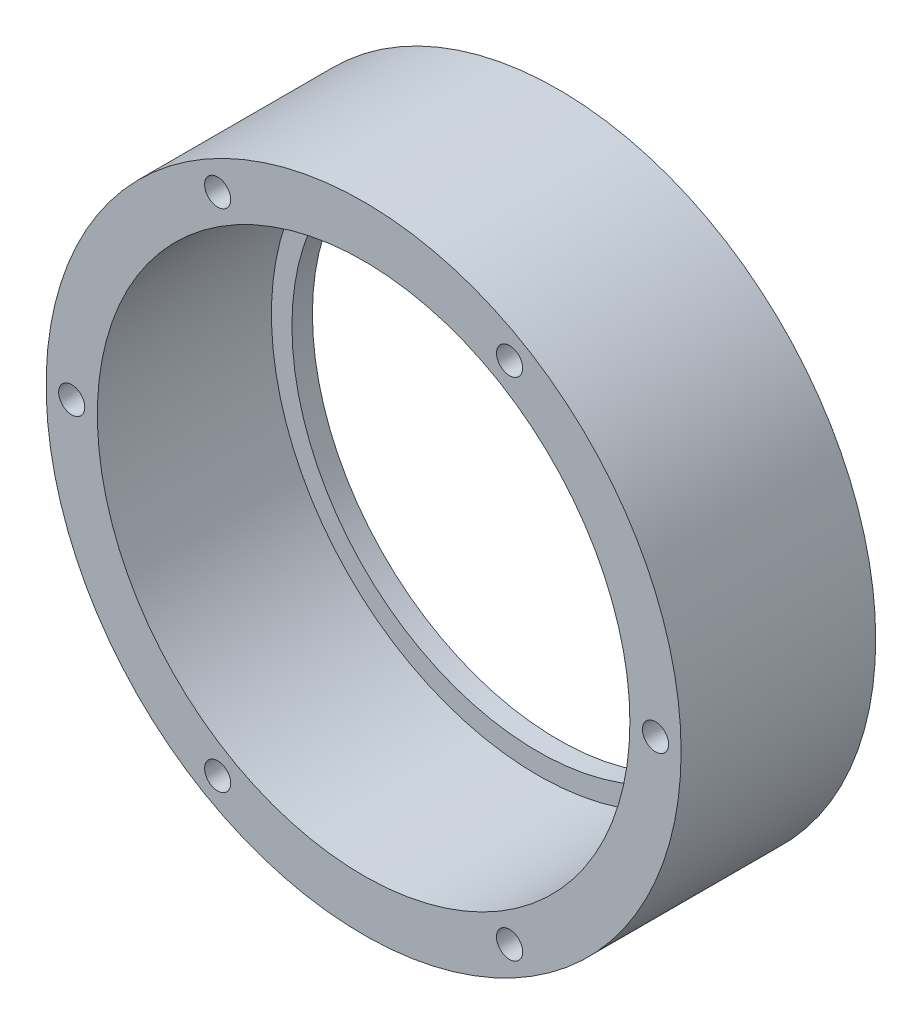
from build123d import *

# Parameters (mm, degrees)
PATTERN_CIRCULAR_1_COUNT = 6


with BuildPart() as part:
    # Эскиз1 → Повернуть1 (revolve)
    with BuildSketch(Plane(origin=(0, 0, 0), x_dir=(0, 0, -1), z_dir=(1, 0, 0))):
        Polygon((0, 31), (19, 31), (19, 24), (17, 24), (17, 26), (0, 26), align=None)
    revolve(axis=Axis((0, 0, 0), (0, 0, -1)))

    # Эскиз3 → Сверло под метчик  спиральное M2.51 (revolve, cut)
    with BuildSketch(Plane(origin=(28.5, 0, 0), x_dir=(0, -1, 0), z_dir=(1, 0, 0))):
        Polygon((0, 0), (0, 8.766097289), (1.275, 8), (1.275, 0), align=None)
    hole_wizard_m2_51 = revolve(axis=Axis((28.5, 0, 6.35), (0, 0, -1)), mode=Mode.SUBTRACT)

    # Круговой массив1: Сверло под метчик  спиральное M2.51 ×6 about axis
    pattern_circular_1_axis = Axis((0, 0, 0), (0, 0, 1))
    for i in range(1, PATTERN_CIRCULAR_1_COUNT):
        add(hole_wizard_m2_51.rotate(pattern_circular_1_axis, i * 360 / PATTERN_CIRCULAR_1_COUNT), mode=Mode.SUBTRACT)


solid = part.part
